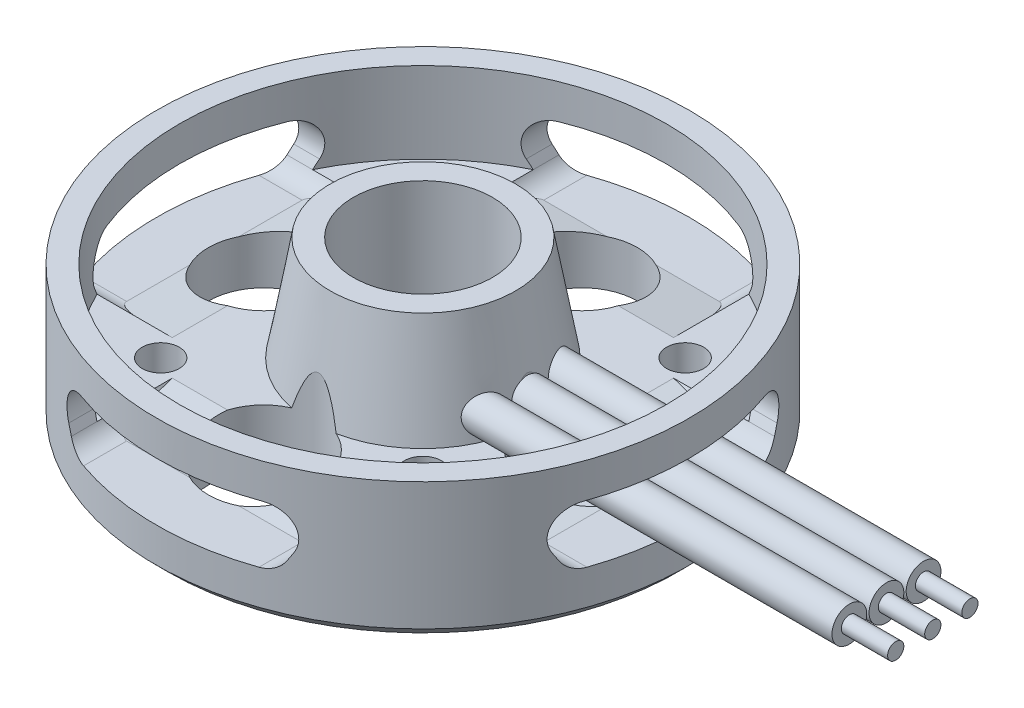
from build123d import *

# Parameters (mm, degrees)
CHAMFER1_SIZE              = 0.5
CUT_EXTRUDE3_DEPTH         = 2.5
CHAMFER4_SIZE2             = 0.5
CHAMFER4_SIZE              = 2.83564091
CIRPATTERN1_START          = -13
CIRPATTERN1_DEPTH          = 25
CIRPATTERN1_2_DEPTH        = 6.83564091
CIRPATTERN1_START_2        = 6.16435899
CIRPATTERN1_3_DEPTH        = 5.83564101
CIRPATTERN1_START_3        = -12
CIRPATTERN1_4_DEPTH        = 5.83564091
CIRPATTERN1_START_4        = -6.16435909
CIRPATTERN1_5_DEPTH        = 10.81491444
CIRPATTERN1_START_5        = 2
CIRPATTERN1_6_DEPTH        = 1.532449105
SKETCH5_R                  = 3
CUT_EXTRUDE4_DEPTH         = 3
SKETCH7_R                  = 2.375
CUT_EXTRUDE5_DEPTH         = 5
CIRPATTERN2_COUNT          = 4
M2_TAPPED_HOLE1_AT_2_COUNT = 2
M2_TAPPED_HOLE1_AT_2_PITCH = 10
CIRPATTERN3_COUNT          = 2
SKETCH11_R                 = 0.75
BOSS_EXTRUDE2_DEPTH        = 20
CUT_EXTRUDE6_START         = -6
SKETCH13_R                 = 3
CUT_EXTRUDE6_DEPTH         = 6
SKETCH14_R                 = 0.35
BOSS_EXTRUDE3_DEPTH        = 2
BOSS_EXTRUDE3_2_DEPTH      = 2
BOSS_EXTRUDE3_3_DEPTH      = 2


with BuildPart() as part:
    # Sketch1 → Revolve1 (revolve)
    with BuildSketch(Plane.XY, mode=Mode.PRIVATE) as revolve1_sk:
        Polygon((0, 0), (11.5, 0), (11.5, 6), (10.5, 6), (10.5, 2.5), (0, 2.5), align=None)
    revolve(revolve1_sk.sketch.rotate(Axis((0, 0, 0), (0, 1, 0)), 90), axis=Axis((0, 0, 0), (0, 1, 0)))

    # Chamfer1
    chamfer1_edges = [part.edges().sort_by_distance(p)[0] for p in [
        (0, 0, 11.5),
    ]]
    chamfer(chamfer1_edges, length=CHAMFER1_SIZE)

    # Sketch4 → Cut-Extrude3 (cut)
    with BuildSketch(Plane.XY.offset(11.5)):
        with BuildLine():
            Line((-3.9, 2.3), (3.9, 2.3))
            ThreePointArc((3.9, 2.3), (5, 3.4), (3.9, 4.5))
            Line((3.9, 4.5), (-3.9, 4.5))
            ThreePointArc((-3.9, 4.5), (-5, 3.4), (-3.9, 2.3))
        make_face()
        with BuildLine():
            ThreePointArc((-3.9, 2.3), (-4.45, 2.447372056), (-4.852627944, 2.85))
            Line((-4.852627944, 2.85), (-4.65055535, 2.5))
            ThreePointArc((-4.65055535, 2.5), (-4.284529946, 2.133974596), (-3.784529946, 2))
            Line((-3.784529946, 2), (3.784529946, 2))
            ThreePointArc((3.784529946, 2), (4.284529946, 2.133974596), (4.65055535, 2.5))
            Line((4.65055535, 2.5), (4.852627944, 2.85))
            ThreePointArc((4.852627944, 2.85), (4.45, 2.447372056), (3.9, 2.3))
            Line((3.9, 2.3), (-3.9, 2.3))
        make_face()
    extrude(amount=-CUT_EXTRUDE3_DEPTH, mode=Mode.SUBTRACT)

    # Chamfer4
    chamfer4_edges = [part.edges().sort_by_distance(p)[0] for p in [
        (0, 2.5, 9),
    ]]
    chamfer4_side = [part.faces().sort_by_distance(p)[0] for p in [
        (0, 2.5, 8.99),
    ]]
    chamfer(chamfer4_edges, length=CHAMFER4_SIZE - 0.0001, length2=CHAMFER4_SIZE2 - 0.0001, reference=chamfer4_side[0])  # a hair under: the kernel refuses the full size

    # CirPattern1: read off the stored shape, not the designer's step
    # CirPattern1 outline → CirPattern1 (cut)
    with BuildSketch(Plane.YZ.offset(CIRPATTERN1_START)):
        with BuildLine():
            Line((2.85, 4.852627944), (2.5, 4.65055535))
            Line((2.5, 4.65055535), (2.5, -4.650555353))
            Line((2.5, -4.650555353), (2.85, -4.852627944))
            ThreePointArc((2.85, -4.852627944), (3.950000187, -4.852627836), (4.5, -3.899999568))
            Line((4.5, -3.899999568), (4.5, 3.899999636))
            ThreePointArc((4.5, 3.899999636), (3.950000158, 4.852627853), (2.85, 4.852627944))
        make_face()
    extrude(amount=CIRPATTERN1_DEPTH, mode=Mode.SUBTRACT)

    # CirPattern1 2 outline → CirPattern1 2 (cut)
    with BuildSketch(Plane.YZ.offset(CIRPATTERN1_START)):
        with BuildLine():
            ThreePointArc((2.500000052, 4.65055538), (2.133974554, 4.284529873), (2, 3.784529717))
            Line((2, 3.784529717), (2, -3.784529759))
            ThreePointArc((2, -3.784529759), (2.133974555, -4.284529875), (2.500000019, -4.650555361))
            Line((2.500000019, -4.650555361), (2.500000052, 4.65055538))
        make_face()
    extrude(amount=CIRPATTERN1_2_DEPTH, mode=Mode.SUBTRACT)

    # CirPattern1 3 outline → CirPattern1 3 (cut)
    with BuildSketch(Plane.YZ.offset(CIRPATTERN1_START_2)):
        with BuildLine():
            ThreePointArc((2.500000052, 4.65055538), (2.133974554, 4.284529873), (2, 3.784529717))
            Line((2, 3.784529717), (2, -3.784529759))
            ThreePointArc((2, -3.784529759), (2.133974555, -4.284529875), (2.500000019, -4.650555361))
            Line((2.500000019, -4.650555361), (2.500000052, 4.65055538))
        make_face()
    extrude(amount=CIRPATTERN1_3_DEPTH, mode=Mode.SUBTRACT)

    # CirPattern1 4 outline → CirPattern1 4 (cut)
    with BuildSketch(Plane.XY.offset(CIRPATTERN1_START_3)):
        with BuildLine():
            Line((-4.852627944, 2.85), (-4.65055538, 2.500000052))
            ThreePointArc((-4.65055538, 2.500000052), (-4.284529873, 2.133974554), (-3.784529717, 2))
            Line((-3.784529717, 2), (3.784529759, 2))
            ThreePointArc((3.784529759, 2), (4.284529875, 2.133974555), (4.650555361, 2.500000019))
            Line((4.650555361, 2.500000019), (4.852627944, 2.85))
            ThreePointArc((4.852627944, 2.85), (4.852627836, 3.950000187), (3.899999568, 4.5))
            Line((3.899999568, 4.5), (-3.899999636, 4.5))
            ThreePointArc((-3.899999636, 4.5), (-4.852627853, 3.950000158), (-4.852627944, 2.85))
        make_face()
    extrude(amount=CIRPATTERN1_4_DEPTH, mode=Mode.SUBTRACT)

    # CirPattern1 5 outline → CirPattern1 5 (add)
    with BuildSketch(Plane.XY.offset(CIRPATTERN1_START_4)):
        Polygon((-6.16435909, 2), (-6.16435909, 2.500000052), (-9, 2), align=None)
        Polygon((9, 2), (6.16435909, 2.5), (6.16435899, 2), align=None)
    extrude(amount=CIRPATTERN1_5_DEPTH)

    # CirPattern1 6 outline → CirPattern1 6 (add)
    with BuildSketch(Plane(origin=(0, 0, 0), x_dir=(1, 0, 0), z_dir=(0, 0.984807753012208, -0.173648177666931)).offset(CIRPATTERN1_START_5)):
        with BuildLine():
            add(Edge.make_bspline(
                [(3.784529946, 8.515973422), (4.361880215, 8.515973422), (4.65055535, 5.63658818)],
                knots=[0, 0, 0, 1.047197551, 1.047197551, 1.047197551], degree=2, weights=[1, 0.866025404, 1]))
            Line((3.784529946, 8.515973422), (-3.784529946, 8.515973422))
            add(Edge.make_bspline(
                [(-4.65055535, 5.63658818), (-4.361880215, 8.515973422), (-3.784529946, 8.515973422)],
                knots=[5.235987756, 5.235987756, 5.235987756, 6.283185307, 6.283185307, 6.283185307], degree=2, weights=[1, 0.866025404, 1]))
            Line((-4.65055535, 5.63658818), (4.65055535, 5.63658818))
        make_face()
    extrude(amount=CIRPATTERN1_6_DEPTH)

    # Sketch5 → Cut-Extrude4 (cut)
    with BuildSketch(Plane.XZ):
        with Locations(Location((0, 0, 0), (0, 0, 270))):
            Circle(SKETCH5_R)
    extrude(amount=-CUT_EXTRUDE4_DEPTH, mode=Mode.SUBTRACT)

    # Sketch6 → Revolve2 (revolve)
    with BuildSketch(Plane(origin=(0, 0, 0), x_dir=(0, 0, -1), z_dir=(1, 0, 0)), mode=Mode.PRIVATE) as revolve2_sk:
        Polygon((-3, 2.5), (-4.8, 2.5), (-4, 7), (-3, 7), align=None)
    revolve(revolve2_sk.sketch.rotate(Axis((0, 0, 0), (0, 1, 0)), 180), axis=Axis((0, 0, 0), (0, 1, 0)))

    # Sketch7 → Cut-Extrude5 (cut)
    with BuildSketch(Plane.XZ):
        with Locations(Location((-6.875, 0, 0), (0, 0, 270))):
            Circle(SKETCH7_R)
    cut_extrude5 = extrude(amount=-CUT_EXTRUDE5_DEPTH, mode=Mode.SUBTRACT)

    # CirPattern2: Cut-Extrude5 ×4 about axis
    cirpattern2_axis = Axis((0, 0, 0), (0, 1, 0))
    for i in range(1, CIRPATTERN2_COUNT):
        add(cut_extrude5.rotate(cirpattern2_axis, i * 360 / CIRPATTERN2_COUNT), mode=Mode.SUBTRACT)

    # Sketch10 → M2 Tapped Hole1 (revolve, cut)
    with BuildSketch(Plane(origin=(4.242640687, 0, 4.242640687), x_dir=(0, 0, -1), z_dir=(1, 0, 0))):
        Polygon((0, 0), (0, 5.680688495), (0.8, 5.2), (0.8, 0), align=None)
    m2_tapped_hole1 = revolve(axis=Axis((4.242640687, -6.35, 4.242640687), (0, 1, 0)), mode=Mode.SUBTRACT)

    # M2 Tapped Hole1 at 2: M2 Tapped Hole1 ×2
    with Locations(*[Vector(0.14142135623730906, 0, -0.9899494936611666) * (i * M2_TAPPED_HOLE1_AT_2_PITCH) for i in range(1, M2_TAPPED_HOLE1_AT_2_COUNT)]):
        add(m2_tapped_hole1, mode=Mode.SUBTRACT)

    # CirPattern3: M2 Tapped Hole1 ×2 about axis
    cirpattern3_axis = Axis((0, 0, 0), (0, 1, 0))
    for i in range(1, CIRPATTERN3_COUNT):
        add(m2_tapped_hole1.rotate(cirpattern3_axis, i * 360 / CIRPATTERN3_COUNT), mode=Mode.SUBTRACT)

    # CirPattern3 copy 1 sketch → CirPattern3 copy 1 (revolve, cut)
    with BuildSketch(Plane(origin=(-5.656854249, 0, 5.656854249), x_dir=(0, 0, 1), z_dir=(-1, 0, 0))):
        Polygon((0, 0), (0, 5.680688495), (0.8, 5.2), (0.8, 0), align=None)
    revolve(axis=Axis((-5.656854249, -6.35, 5.656854249), (0, 1, 0)), mode=Mode.SUBTRACT)

    # Sketch11 → Boss-Extrude2 (add)
    with BuildSketch(Plane(origin=(0, 0, 0), x_dir=(0, 0, -1), z_dir=(1, 0, 0))):
        with Locations(Location((-1.6, 3.35, 0), (0, 0, 314.427757081))):
            Circle(SKETCH11_R)
        with Locations(Location((1.6, 3.35, 0), (0, 0, 316.997410618))):
            Circle(SKETCH11_R)
        with Locations(Location((0, 3.35, 0), (0, 0, 191.283490021))):
            Circle(SKETCH11_R)
    extrude(amount=BOSS_EXTRUDE2_DEPTH)

    # Sketch13 → Cut-Extrude6 (cut)
    with BuildSketch(Plane(origin=(0, 7, 0), x_dir=(1, 0, 0), z_dir=(0, 1, 0)).offset(CUT_EXTRUDE6_START)):
        with Locations(Location((0, 0, 0), (0, 0, 90))):
            Circle(SKETCH13_R)
    extrude(amount=CUT_EXTRUDE6_DEPTH, mode=Mode.SUBTRACT)


with BuildPart() as body_2:
    # Sketch8 → Revolve3 (revolve)
    with BuildSketch(Plane.XY, mode=Mode.PRIVATE) as revolve3_sk:
        with BuildLine():
            Line((9.25, 0), (9.25, 1.5))
            Line((9.25, 1.5), (6.875, 1.5))
            Line((6.875, 1.5), (6.875, 1))
            ThreePointArc((6.875, 1), (8.163470508, 0.739804957), (9.25, 0))
        make_face()
    revolve(revolve3_sk.sketch.rotate(Axis((6.875, 0, 0), (0, 1, 0)), 90), axis=Axis((6.875, 0, 0), (0, 1, 0)))


with BuildPart() as body_3:
    # Sketch14 → Boss-Extrude3 (new body)
    with BuildSketch(Plane(origin=(20, 0, 0), x_dir=(0, 0, -1), z_dir=(1, 0, 0))):
        with Locations((-1.6, 3.35)):
            Circle(SKETCH14_R)
    extrude(amount=BOSS_EXTRUDE3_DEPTH)


with BuildPart() as body_4:
    # Sketch14 → Boss-Extrude3 2 (new body)
    with BuildSketch(Plane(origin=(20, 0, 0), x_dir=(0, 0, -1), z_dir=(1, 0, 0))):
        with Locations((0, 3.35)):
            Circle(SKETCH14_R)
    extrude(amount=BOSS_EXTRUDE3_2_DEPTH)


with BuildPart() as body_5:
    # Sketch14 → Boss-Extrude3 3 (new body)
    with BuildSketch(Plane(origin=(20, 0, 0), x_dir=(0, 0, -1), z_dir=(1, 0, 0))):
        with Locations((1.6, 3.35)):
            Circle(SKETCH14_R)
    extrude(amount=BOSS_EXTRUDE3_3_DEPTH)


solid = Compound([part.part, body_2.part, body_3.part, body_4.part, body_5.part])
